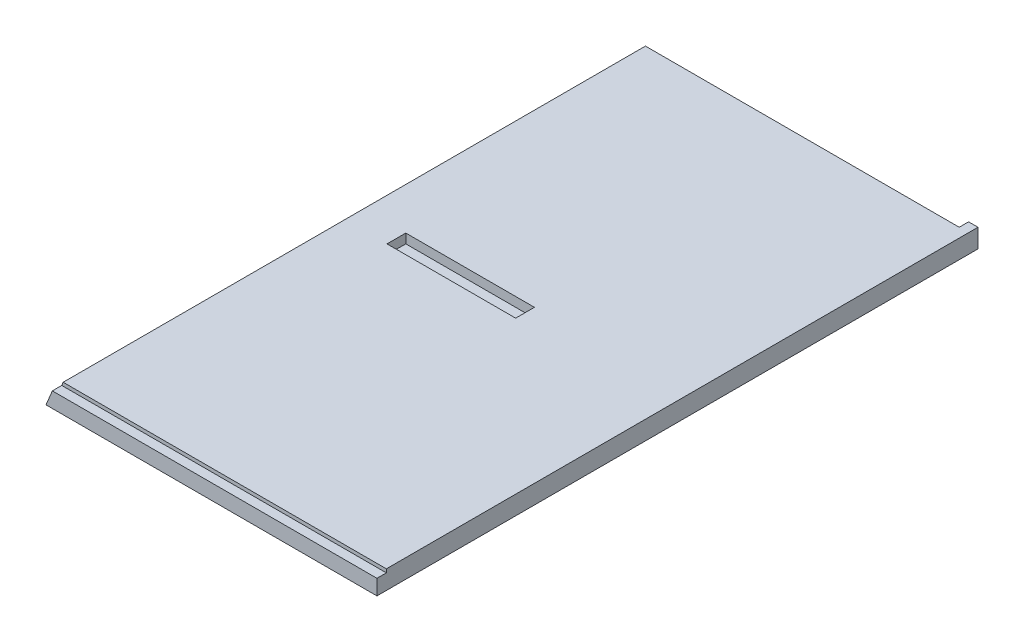
from build123d import *

# Parameters (mm, degrees)
BOSS_EXTRUDE1_DEPTH = 406.4
SKETCH2_W           = 239.802769694
SKETCH2_H           = 6.35
CUT_EXTRUDE1_DEPTH  = 6.35
SKETCH3_W           = 223.774
SKETCH3_H           = 6.35
CUT_EXTRUDE2_DEPTH  = 2.3622
CAVITY1_START       = 6.35
CAVITY1_OUTLINE_W   = 86.976200951
CAVITY1_OUTLINE_H   = 12.7
CAVITY1_DEPTH       = 6.35


# Read off the part's stored shape, not the designer's step: Cavity1
with BuildPart() as part:
    # Sketch1 → Boss-Extrude1 (new body)
    with BuildSketch(Plane.XY):
        Polygon((0, 0), (5.260512242, 12.7), (223.774, 12.7), (223.774, 0), align=None)
    extrude(amount=BOSS_EXTRUDE1_DEPTH)

    # Sketch2 → Cut-Extrude1 (cut)
    with BuildSketch(Plane.XZ.offset(-12.7)):
        with Locations((97.522615153, 3.175)):
            Rectangle(SKETCH2_W, SKETCH2_H)
    extrude(amount=CUT_EXTRUDE1_DEPTH, mode=Mode.SUBTRACT)

    # Sketch3 → Cut-Extrude2 (cut)
    with BuildSketch(Plane.XZ.offset(-12.7)):
        with Locations((111.887, 403.225)):
            Rectangle(SKETCH3_W, SKETCH3_H)
    extrude(amount=CUT_EXTRUDE2_DEPTH, mode=Mode.SUBTRACT)

    # Cavity1 outline → Cavity1 (cut)
    with BuildSketch(Plane(origin=(0, 0, 0), x_dir=(1, 0, 0), z_dir=(0, 1, 0)).offset(CAVITY1_START)):
        with Locations((77.210447741, -203.2)):
            Rectangle(CAVITY1_OUTLINE_W, CAVITY1_OUTLINE_H)
    extrude(amount=CAVITY1_DEPTH, mode=Mode.SUBTRACT)


solid = part.part
